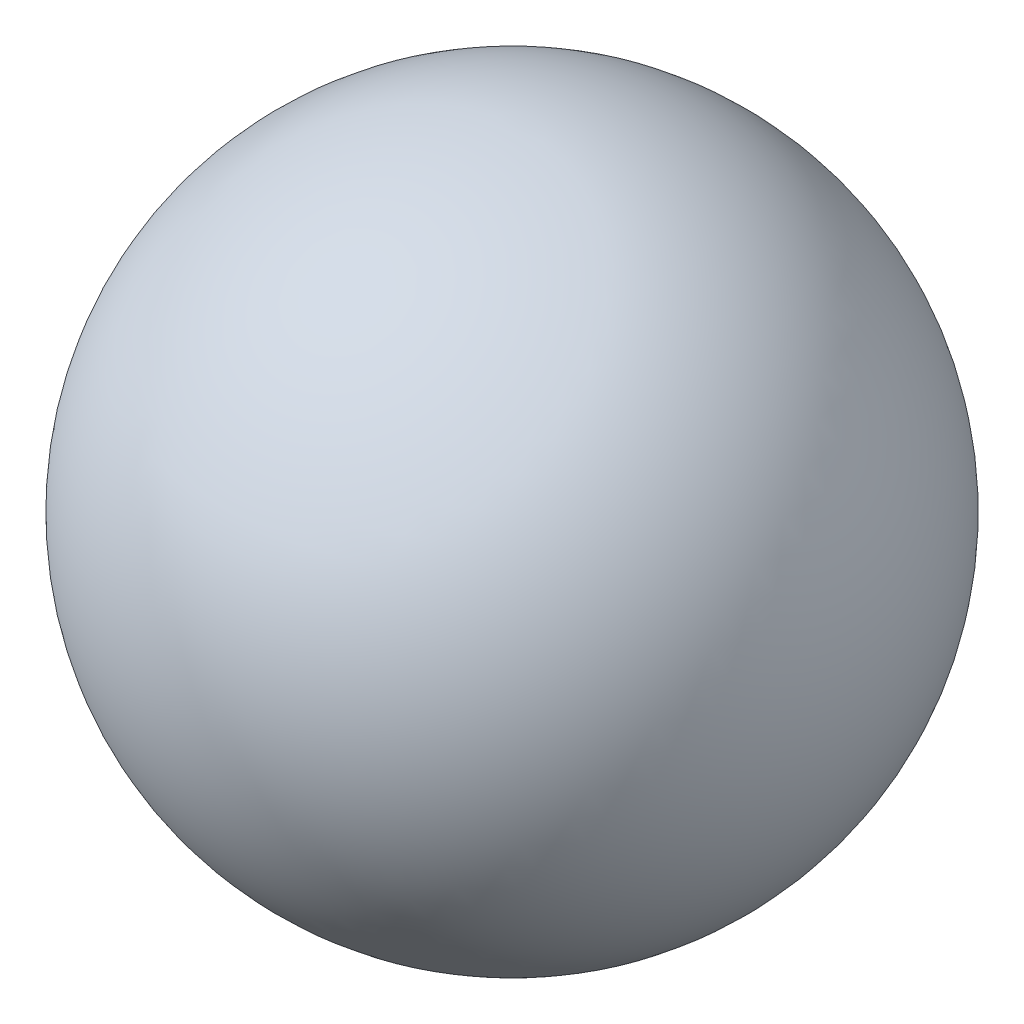
from build123d import *


with BuildPart() as part:
    # ｽｹｯﾁ1 → 回転1 (revolve)
    with BuildSketch(Plane.XY):
        with BuildLine():
            ThreePointArc((0, -120), (120, 0), (0, 120))
            Line((0, 120), (0, -120))
        make_face()
    revolve(axis=Axis((0, 120, 0), (0, -1, 0)))


solid = part.part
